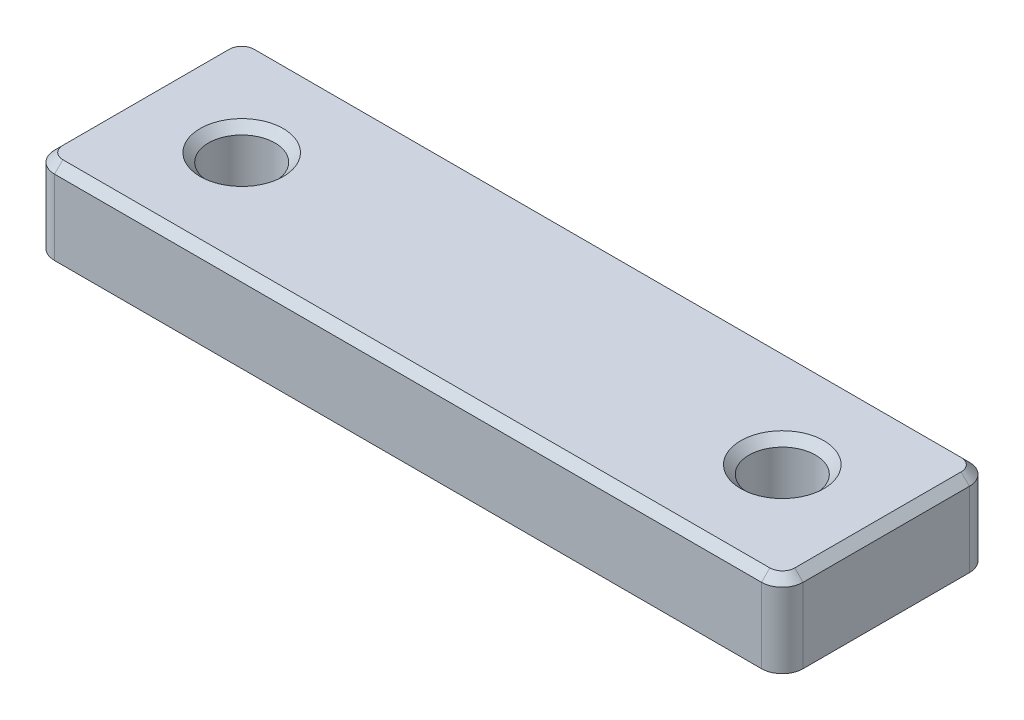
from build123d import *

# Parameters (mm, degrees)
SKETCH_1_W      = 36
SKETCH_1_H      = 10
SKETCH_1_R      = 1.6
EXTRUDE_1_DEPTH = 4
FILLET_1_R      = 1
CHAMFER_1_SIZE  = 0.4


with BuildPart() as part:
    # 草图1 → 凸台-拉伸1 (new body)
    with BuildSketch(Plane(origin=(0, 0, 0), x_dir=(1, 0, 0), z_dir=(0, 1, 0))):
        with Locations((18, -5)):
            Rectangle(SKETCH_1_W, SKETCH_1_H)
        with Locations((5, -5)):
            Circle(SKETCH_1_R, mode=Mode.SUBTRACT)
        with Locations((31, -5)):
            Circle(SKETCH_1_R, mode=Mode.SUBTRACT)
    extrude(amount=EXTRUDE_1_DEPTH)

    # 圆角1
    fillet_1_edges = [part.edges().sort_by_distance(p)[0] for p in [
        (0, 2, 0),
        (36, 2, 0),
        (36, 2, 10),
        (0, 2, 10),
    ]]
    fillet(fillet_1_edges, radius=FILLET_1_R)

    # 倒角1
    chamfer_1_edges = [part.edges().sort_by_distance(p)[0] for p in [
        (29.4, 4, 5),
        (18, 4, 0),
        (36, 4, 5),
        (18, 4, 10),
        (0, 4, 5),
        (3.4, 4, 5),
        (35.707106781, 4, 0.292893219),
        (35.707106781, 4, 9.707106781),
        (0.292893219, 4, 9.707106781),
        (0.292893219, 4, 0.292893219),
    ]]
    chamfer(chamfer_1_edges, length=CHAMFER_1_SIZE)


solid = part.part
